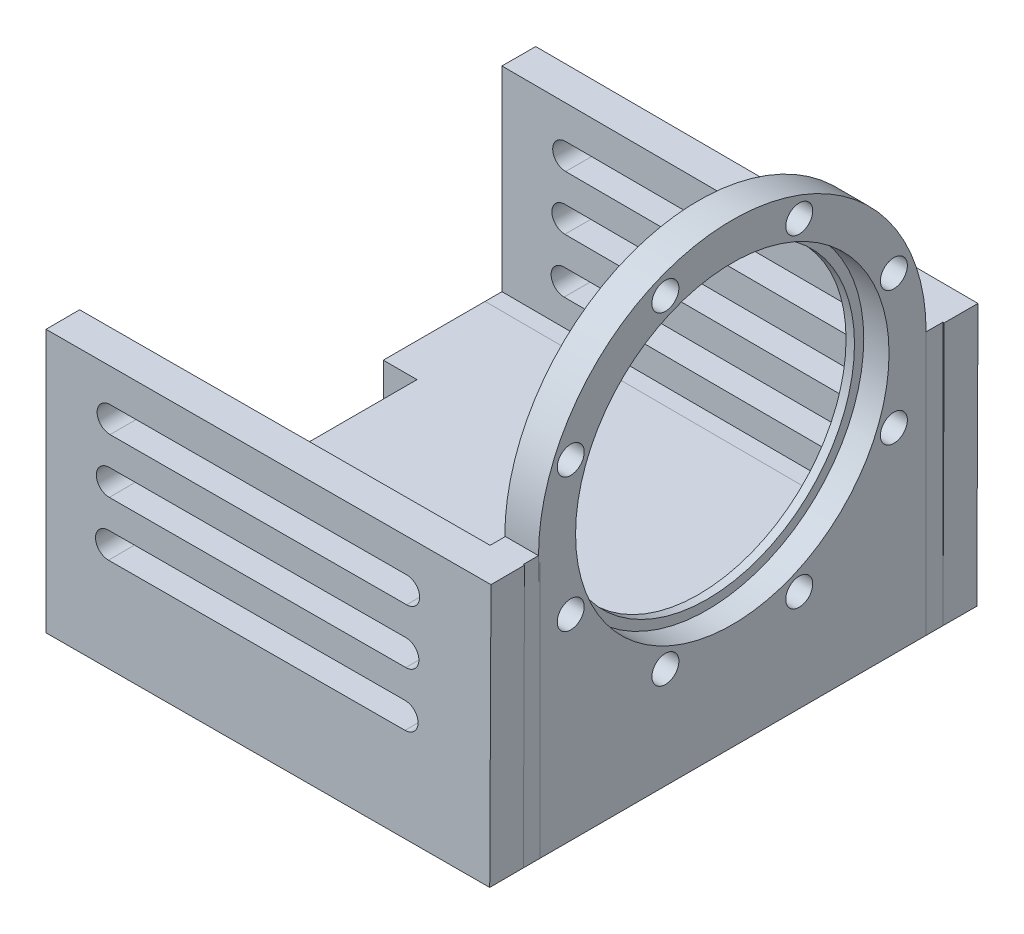
from build123d import *

# Parameters (mm, degrees)
SKETCH_1_R                = 1.6
SKETCH_1_R_2              = 18.6
EXTRUDE_1_DEPTH           = 4
EXTRUDE_2_DEPTH           = 1
SKETCH_2_W                = 4
SKETCH_2_H                = 46
EXTRUDE_3_DEPTH           = 8
SKETCH_3_R                = 1.85
CUT_EXTRUDE_1_DEPTH       = 5
CHAMFER_2_SIZE            = 0.4
EXTRUDE_7_DEPTH           = 2
EXTRUDE_8_DEPTH           = 4
SKETCH_6_R                = 15
SKETCH_6_R_2              = 10
EXTRUDE_9_DEPTH           = 60
RIB_24_REACH              = 108.905
SKETCH_12_WALL_W          = 236.72683344
SKETCH_12_WALL_H          = 5
PATTERN_CIRCULAR_13_COUNT = 2
RIB_25_REACH              = 108.475
SKETCH_13_WALL_W          = 234.85356175
SKETCH_13_WALL_H          = 5
PATTERN_CIRCULAR_14_COUNT = 2
EXTRUDE_10_DEPTH          = 4
SPLIT_START               = -95.2
SPLIT_BODIES_1_DEPTH      = 64


# Read off the part's stored shape, not the designer's step: 分割1
with BuildPart() as part:
    # 草图1 → 凸台-拉伸1 (new body)
    with BuildSketch(Plane(origin=(0, 0, 0), x_dir=(0, 0, -1), z_dir=(1, 0, 0))):
        with BuildLine():
            ThreePointArc((23, 0), (0, 23), (-23, 0))
            Line((-23, 0), (-23, -23.2))
            Line((-23, -23.2), (23, -23.2))
            Line((23, -23.2), (23, 0))
        make_face()
        with Locations((-7.942246996, -19.174280415)):
            Circle(SKETCH_1_R, mode=Mode.SUBTRACT)
        with Locations((-19.174280415, -7.942246996)):
            Circle(SKETCH_1_R, mode=Mode.SUBTRACT)
        with Locations((7.942246996, -19.174280415)):
            Circle(SKETCH_1_R, mode=Mode.SUBTRACT)
        with Locations((19.174280415, -7.942246996)):
            Circle(SKETCH_1_R, mode=Mode.SUBTRACT)
        with Locations((-19.174280415, 7.942246996)):
            Circle(SKETCH_1_R, mode=Mode.SUBTRACT)
        with Locations((-7.942246996, 19.174280415)):
            Circle(SKETCH_1_R, mode=Mode.SUBTRACT)
        Circle(SKETCH_1_R_2, mode=Mode.SUBTRACT)
        with Locations((19.174280415, 7.942246996)):
            Circle(SKETCH_1_R, mode=Mode.SUBTRACT)
        with Locations((7.942246996, 19.174280415)):
            Circle(SKETCH_1_R, mode=Mode.SUBTRACT)
    extrude(amount=EXTRUDE_1_DEPTH)

    # 草图1<3> → 凸台-拉伸2 (add)
    with BuildSketch(Plane(origin=(0, 0, 0), x_dir=(0, 0, -1), z_dir=(1, 0, 0))):
        with BuildLine():
            ThreePointArc((18.6, 0), (0, 18.6), (-18.6, 0))
            ThreePointArc((-18.6, 0), (0, -18.6), (18.6, 0))
        make_face()
        with BuildLine():
            ThreePointArc((17.5, 0), (0, -17.5), (-17.5, 0))
            ThreePointArc((-17.5, 0), (0, 17.5), (17.5, 0))
        make_face(mode=Mode.SUBTRACT)
    extrude(amount=EXTRUDE_2_DEPTH)

    # 草图2 → 凸台-拉伸3 (add)
    with BuildSketch(Plane.XZ.offset(23.2)):
        Polygon((0, -23), (0, 23), (-48.499757106, 23), (-48.499757106, 10.920150371), (-44.499757106, 10.920150371), (-44.499757106, -11.079849629), (-48.499757106, -11.079849629), (-48.499757106, -23.159699257), (4, -23), align=None)
        with Locations((2, 0)):
            Rectangle(SKETCH_2_W, SKETCH_2_H)
    extrude(amount=EXTRUDE_3_DEPTH)

    # 草图3 → 切除-拉伸1 (cut)
    with BuildSketch(Plane.ZY.offset(44.499757106)):
        with Locations((5.920150371, -27.2)):
            Circle(SKETCH_3_R)
        with Locations((-6.079849629, -27.2)):
            Circle(SKETCH_3_R)
    extrude(amount=-CUT_EXTRUDE_1_DEPTH, mode=Mode.SUBTRACT)

    # 倒角2
    chamfer_2_edges = [part.edges().sort_by_distance(p)[0] for p in [
        (-44.499757106, -27.2, -7.929849629),
        (-44.499757106, -27.2, 4.070150371),
    ]]
    chamfer(chamfer_2_edges, length=CHAMFER_2_SIZE)

    # 草图6 → 凸台-拉伸9 (add)
    with BuildSketch(Plane.XZ.offset(31.2)):
        with Locations(Location((-22.23771099, -0.1, 0), (0, 0, 270))):
            Circle(SKETCH_6_R)
        with Locations(Location((-22.23771099, -0.1, 0), (0, 0, 270))):
            Circle(SKETCH_6_R_2, mode=Mode.SUBTRACT)
    extrude(amount=EXTRUDE_9_DEPTH)

    # 草图12 wall → 筋24 (add, up to next)
    with BuildSketch(Plane(origin=(-5.361401372, -38.595476089, -14.822347737), x_dir=(0.532846585871, 0.707106781177, -0.464838161019), z_dir=(-0.532846585853, 0.707106781196, 0.46483816101)), mode=Mode.PRIVATE) as rib_24_sk1:
        Rectangle(SKETCH_12_WALL_W, SKETCH_12_WALL_H)
    rib_24_tool1 = extrude(rib_24_sk1.sketch, amount=RIB_24_REACH, mode=Mode.PRIVATE) - part.part
    rib_24 = rib_24_tool1.solids().sort_by_distance((-5.361401372, -38.595476089, -14.822347737))[0]
    add(rib_24)

    # 阵列(圆周)13: 筋24 ×2 about axis
    pattern_circular_13_axis = Axis((-22.23771099, -91.2, -0.1), (0, 1, 0))
    for i in range(1, PATTERN_CIRCULAR_13_COUNT):
        add(rib_24.rotate(pattern_circular_13_axis, i * 360 / PATTERN_CIRCULAR_13_COUNT))

    # 草图13 wall → 筋25 (add, up to next)
    with BuildSketch(Plane(origin=(-6.655035456, -38.237231079, 15.482675535), x_dir=(0.500000000026, 0.707106781186, 0.499999999976), z_dir=(-0.499999999999, 0.707106781187, -0.499999999999)), mode=Mode.PRIVATE) as rib_25_sk1:
        Rectangle(SKETCH_13_WALL_W, SKETCH_13_WALL_H)
    rib_25_tool1 = extrude(rib_25_sk1.sketch, amount=RIB_25_REACH, mode=Mode.PRIVATE) - part.part
    rib_25 = rib_25_tool1.solids().sort_by_distance((-6.655035456, -38.237231079, 15.482675535))[0]
    add(rib_25)

    # 阵列(圆周)14: 筋25 ×2 about axis
    pattern_circular_14_axis = Axis((-22.23771099, -91.2, -0.1), (0, 1, 0))
    for i in range(1, PATTERN_CIRCULAR_14_COUNT):
        add(rib_25.rotate(pattern_circular_14_axis, i * 360 / PATTERN_CIRCULAR_14_COUNT))

    # 草图16 → 凸台-拉伸10 (add)
    with BuildSketch(Plane.XZ.offset(91.2)):
        Polygon((-22.249878553, 23), (7.749520178, 22.810063751), (7.749520178, -23.2), (-22.225543428, -23.2), (-52.225543428, -23.2), (-52.225543428, 23), align=None)
    extrude(amount=EXTRUDE_10_DEPTH)

    # Split Bodies 1 outline → Split Bodies 1 (cut)
    with BuildSketch(Plane(origin=(0, 0, 0), x_dir=(1, 0, 0), z_dir=(0, 1, 0)).offset(SPLIT_START)):
        Polygon((-52.225543428, -23), (-22.249878553, -23), (7.749520178, -22.810063751), (7.749520178, 23.2), (-52.225543428, 23.2), align=None)
    extrude(amount=SPLIT_BODIES_1_DEPTH, mode=Mode.SUBTRACT)


with BuildPart() as body_2:
    # 草图4 → 凸台-拉伸7 (new, along a direction that is not the sketch's normal)
    with BuildSketch(Plane(origin=(0.070000173, 0, -23.011954685), x_dir=(-0.9999953734400472, 0, -0.003041890612873783), z_dir=(0.003041890612873783, 0, -0.9999953734400472))):
        Polygon((-3.93001801, 0), (0, 0), (0, -23.2), (48.56998199, -23.2), (48.56998199, -31.2), (-3.93001801, -31.2), align=None)
    extrude(amount=EXTRUDE_7_DEPTH, dir=(0, 0, -1))

    # 草图5 → 凸台-拉伸8 (add)
    with BuildSketch(Plane(origin=(0.076083926, 0, -25.011936179), x_dir=(-0.9999953734400472, 0, -0.0030418906128740326), z_dir=(0.0030418906128740326, 0, -0.9999953734400472))):
        Polygon((-4.069944978, 0), (-3.923934228, -31.2), (48.576065772, -31.2), (48.576065772, 0), align=None)
        with BuildLine():
            Line((5.907026727, -3.964013685), (40.991495952, -3.964013685))
            ThreePointArc((40.991495952, -3.964013685), (42.532674187, -5.50519192), (40.991495952, -7.046370155))
            Line((40.991495952, -7.046370155), (5.907026727, -7.046370155))
            ThreePointArc((5.907026727, -7.046370155), (4.365848493, -5.50519192), (5.907026727, -3.964013685))
        make_face(mode=Mode.SUBTRACT)
        with BuildLine():
            Line((6.000496452, -10.463341605), (41.084965677, -10.463341605))
            ThreePointArc((41.084965677, -10.463341605), (42.626143912, -12.00451984), (41.084965677, -13.545698074))
            Line((41.084965677, -13.545698074), (6.000496452, -13.545698074))
            ThreePointArc((6.000496452, -13.545698074), (4.459318217, -12.00451984), (6.000496452, -10.463341605))
        make_face(mode=Mode.SUBTRACT)
        with BuildLine():
            Line((6.093966177, -16.962669525), (41.178435402, -16.962669525))
            ThreePointArc((41.178435402, -16.962669525), (42.719613636, -18.50384776), (41.178435402, -20.045025994))
            Line((41.178435402, -20.045025994), (6.093966177, -20.045025994))
            ThreePointArc((6.093966177, -20.045025994), (4.552787942, -18.50384776), (6.093966177, -16.962669525))
        make_face(mode=Mode.SUBTRACT)
    extrude(amount=EXTRUDE_8_DEPTH)


with BuildPart() as body_3:
    # 镜向3: mirrored copy
    add(body_2.part.mirror(Plane.XY))


with BuildPart() as body_3_1:
    # Move Body 1: moved
    add(body_3.part.moved(Location((0, 0, -0.2))))


solid = Compound([part.part, body_2.part, body_3_1.part])
